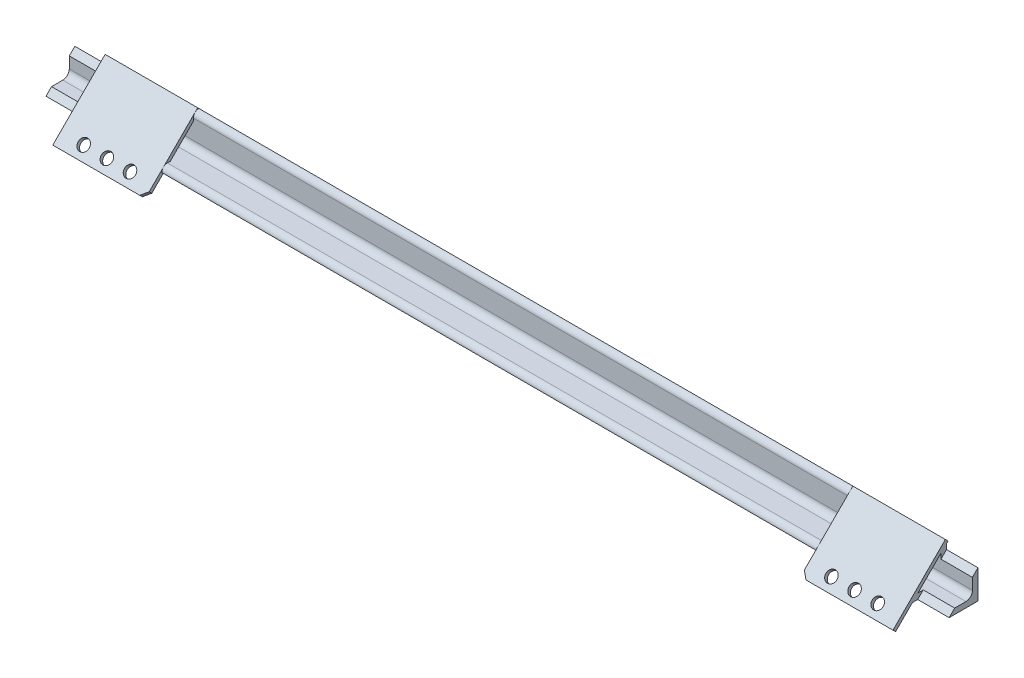
from build123d import *

# Parameters (mm, degrees)
HIERRO_ANGULAR_20_X_20_X_3_1_DEPTH = 488
CROQUIS3_W                         = 67
CROQUIS3_H                         = 40.041630561
CROQUIS3_R                         = 3
SALIENTE_EXTRUIR1_DEPTH            = 2
CHAFL_N1_SIZE                      = 3
CROQUIS4_W                         = 17
CROQUIS4_H                         = 4
CORTAR_EXTRUIR1_DEPTH              = 248.824532079
SIMETR_A3_START                    = -16.899494837
SIMETR_A3_OUTLINE_W                = 50
SIMETR_A3_OUTLINE_H                = 2
SIMETR_A3_DEPTH                    = 31.041630461
SIMETR_A3_START_2                  = 217.5000001
SIMETR_A3_2_DEPTH                  = 9.4999999
SIMETR_A3_START_3                  = 180
SIMETR_A3_3_DEPTH                  = 6.4999999
SIMETR_A3_START_4                  = 192.5000001
SIMETR_A3_4_DEPTH                  = 6.4999998
SIMETR_A3_START_5                  = 205.0000001
SIMETR_A3_5_DEPTH                  = 6.4999998
SIMETR_A3_START_6                  = 11.02081528
SIMETR_A3_6_DEPTH                  = 4
SIMETR_A3_START_7                  = 13.02081528
SIMETR_A3_7_DEPTH                  = 2


with BuildPart() as part:
    # Sketch1 → Hierro angular 20 X 20 X 3(1) (new body)
    with BuildSketch(Plane.YZ.offset(-244)):
        with BuildLine():
            Line((0, 0), (0, 20))
            ThreePointArc((0, 20), (2.121320344, 19.121320344), (3, 17))
            Line((3, 17), (3, 6.5))
            ThreePointArc((3, 6.5), (4.025126266, 4.025126266), (6.5, 3))
            Line((6.5, 3), (17, 3))
            ThreePointArc((17, 3), (19.121320344, 2.121320344), (20, 0))
            Line((20, 0), (0, 0))
        make_face()
    extrude(amount=HIERRO_ANGULAR_20_X_20_X_3_1_DEPTH)


with BuildPart() as body_2:
    # Croquis3 → Saliente-Extruir1 (new body)
    with BuildSketch(Plane(origin=(0, 10.621320344, 10.621320344), x_dir=(1, 0, 0), z_dir=(0, 0.7071067811865477, 0.7071067811865475))):
        with Locations((-210.5, -5.878679656)):
            Rectangle(CROQUIS3_W, CROQUIS3_H)
        with Locations(Location((-189.5, -19.899494937, 0), (0, 0, 270))):
            Circle(CROQUIS3_R, mode=Mode.SUBTRACT)
        with Locations(Location((-202, -19.899494937, 0), (0, 0, 270))):
            Circle(CROQUIS3_R, mode=Mode.SUBTRACT)
        with Locations(Location((-214.5, -19.899494937, 0), (0, 0, 270))):
            Circle(CROQUIS3_R, mode=Mode.SUBTRACT)
    extrude(amount=-SALIENTE_EXTRUIR1_DEPTH)

    # Chaflán1
    chafl_n1_edges = [body_2.edges().sort_by_distance(p)[0] for p in [
        (-177, -8.399494937, 28.227922061),
        (-244, -8.399494937, 28.227922061),
    ]]
    chamfer(chafl_n1_edges, length=CHAFL_N1_SIZE)


with BuildPart() as cortar_extruir1_tool:
    # Croquis4 → Cortar-Extruir1 (new, through all)
    with BuildSketch(Plane(origin=(0, -18.313708499, 18.313708499), x_dir=(1, 0, 0), z_dir=(0, -0.7071067811865476, 0.7071067811865476))):
        with Locations((-235.5, 13.02081528)):
            Rectangle(CROQUIS4_W, CROQUIS4_H)
    extrude(amount=-CORTAR_EXTRUIR1_DEPTH)


with BuildPart() as part_1:
    add(part.part)

    # Cortar-Extruir1: cut by cortar_extruir1_tool
    add(cortar_extruir1_tool.part, mode=Mode.SUBTRACT)

    # Simetría3: read off the stored shape, not the designer's step
    # Simetría3 outline → Simetría3 (add)
    with BuildSketch(Plane(origin=(0, 0, 0), x_dir=(1, 0, 0), z_dir=(0, 0.707106781186547, -0.707106781186548)).offset(SIMETR_A3_START)):
        with Locations((202, -14.02081528)):
            Rectangle(SIMETR_A3_OUTLINE_W, SIMETR_A3_OUTLINE_H)
    extrude(amount=SIMETR_A3_DEPTH)

    # Simetr_a3 2 outline → Simetr_a3 2 (add)
    with BuildSketch(Plane.YZ.offset(SIMETR_A3_START_2)):
        Polygon((-2.742640617, 21.156854179), (-1.328427054, 22.571067741), (-7.692388155, 28.935028843), (-9.106601718, 27.52081528), align=None)
    extrude(amount=SIMETR_A3_2_DEPTH)

    # Simetr_a3 3 outline → Simetr_a3 3 (add)
    with BuildSketch(Plane.YZ.offset(SIMETR_A3_START_3)):
        Polygon((-2.742640617, 21.156854179), (-1.328427054, 22.571067741), (-7.692388155, 28.935028843), (-9.106601718, 27.52081528), align=None)
    extrude(amount=SIMETR_A3_3_DEPTH)

    # Simetr_a3 4 outline → Simetr_a3 4 (add)
    with BuildSketch(Plane.YZ.offset(SIMETR_A3_START_4)):
        Polygon((-2.742640617, 21.156854179), (-1.328427054, 22.571067741), (-7.692388155, 28.935028843), (-9.106601718, 27.52081528), align=None)
    extrude(amount=SIMETR_A3_4_DEPTH)

    # Simetr_a3 5 outline → Simetr_a3 5 (add)
    with BuildSketch(Plane.YZ.offset(SIMETR_A3_START_5)):
        Polygon((-2.742640617, 21.156854179), (-1.328427054, 22.571067741), (-7.692388155, 28.935028843), (-9.106601718, 27.52081528), align=None)
    extrude(amount=SIMETR_A3_5_DEPTH)

    # Simetr_a3 6 outline → Simetr_a3 6 (cut)
    with BuildSketch(Plane(origin=(0, 0, 0), x_dir=(1, 0, 0), z_dir=(0, 0.707106781186548, 0.707106781186547)).offset(SIMETR_A3_START_6)):
        Polygon((244, 16), (227, 16), (227, -25.899494937), (217.5000001, -25.899494937), (217.5000001, -27), (244, -27), align=None)
    extrude(amount=SIMETR_A3_6_DEPTH, mode=Mode.SUBTRACT)

    # Simetr_a3 7 outline → Simetr_a3 7 (add)
    with BuildSketch(Plane(origin=(0, 0, 0), x_dir=(1, 0, 0), z_dir=(0, 0.707106781186548, 0.707106781186547)).offset(SIMETR_A3_START_7)):
        Polygon((180, -16.899494837), (177, -16.899494837), (177, -22.899494937), (180, -25.899494937), align=None)
        with BuildLine():
            Line((186.5, -19.899494937), (186.4999999, -25.899494937))
            Line((186.4999999, -25.899494937), (192.5000001, -25.899494937))
            Line((192.5000001, -25.899494937), (192.5, -19.899494937))
            ThreePointArc((192.5, -19.899494937), (189.5, -22.899494937), (186.5, -19.899494937))
        make_face()
        with BuildLine():
            Line((186.4999999, -16.899494836), (186.5, -19.899494937))
            ThreePointArc((186.5, -19.899494937), (187.378679656, -17.778174593), (189.5, -16.899494937))
            Line((189.5, -16.899494937), (186.4999999, -16.899494836))
        make_face()
        with BuildLine():
            Line((211.4999999, -25.899494937), (217.5000001, -25.899494937))
            Line((217.5000001, -25.899494937), (217.5, -19.899494937))
            ThreePointArc((217.5, -19.899494937), (214.5, -22.899494937), (211.5, -19.899494937))
            Line((211.5, -19.899494937), (211.4999999, -25.899494937))
        make_face()
        with BuildLine():
            Line((199, -19.899494937), (198.9999999, -25.899494937))
            Line((198.9999999, -25.899494937), (205.0000001, -25.899494937))
            Line((205.0000001, -25.899494937), (205, -19.899494937))
            ThreePointArc((205, -19.899494937), (202, -22.899494937), (199, -19.899494937))
        make_face()
        with BuildLine():
            ThreePointArc((189.5, -16.899494937), (191.621320344, -17.778174593), (192.5, -19.899494937))
            Line((192.5, -19.899494937), (192.5000001, -16.899494836))
            Line((192.5000001, -16.899494836), (189.5, -16.899494937))
        make_face()
        with BuildLine():
            ThreePointArc((214.5, -16.899494937), (216.621320344, -17.778174593), (217.5, -19.899494937))
            Line((217.5, -19.899494937), (217.5000001, -16.899494836))
            Line((217.5000001, -16.899494836), (214.5, -16.899494937))
        make_face()
        with BuildLine():
            Line((198.9999999, -16.899494836), (199, -19.899494937))
            ThreePointArc((199, -19.899494937), (199.878679656, -17.778174593), (202, -16.899494937))
            Line((202, -16.899494937), (198.9999999, -16.899494836))
        make_face()
        with BuildLine():
            Line((211.4999999, -16.899494836), (211.5, -19.899494937))
            ThreePointArc((211.5, -19.899494937), (212.378679656, -17.778174593), (214.5, -16.899494937))
            Line((214.5, -16.899494937), (211.4999999, -16.899494836))
        make_face()
        with BuildLine():
            ThreePointArc((202, -16.899494937), (204.121320344, -17.778174593), (205, -19.899494937))
            Line((205, -19.899494937), (205.0000001, -16.899494836))
            Line((205.0000001, -16.899494836), (202, -16.899494937))
        make_face()
    extrude(amount=SIMETR_A3_7_DEPTH)


with BuildPart() as body_2_1:
    add(body_2.part)

    # Cortar-Extruir1: cut by cortar_extruir1_tool
    add(cortar_extruir1_tool.part, mode=Mode.SUBTRACT)


solid = Compound([part_1.part, body_2_1.part])
